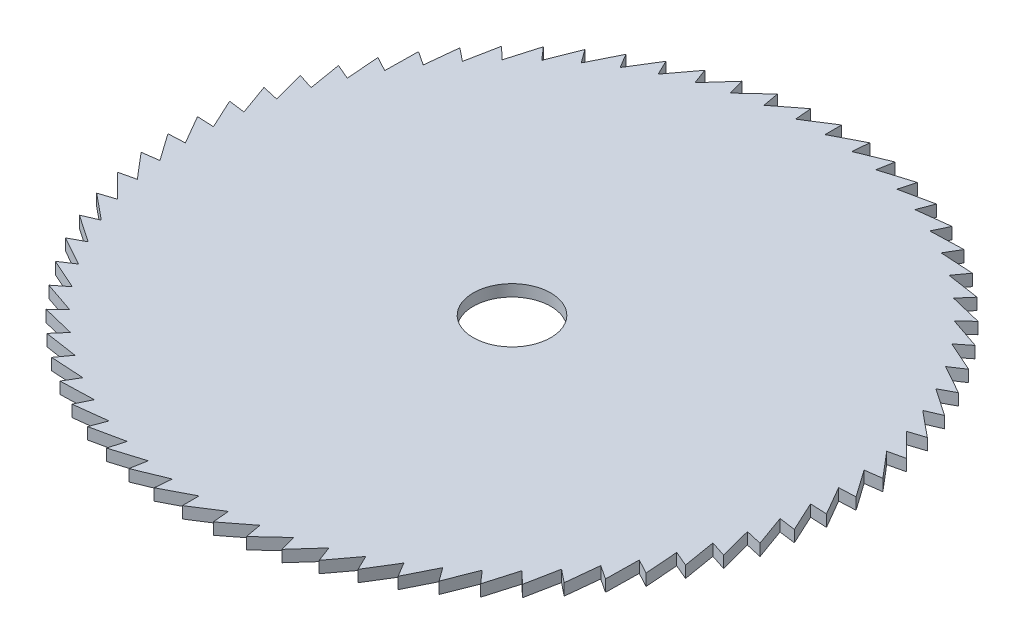
from build123d import *

# Parameters (mm, degrees)
SKETCH_1_R               = 25.5
SKETCH_1_R_2             = 3
EXTRUDE_1_DEPTH          = 0.9
CUT_EXTRUDE_2_DEPTH      = 0.9
PATTERN_CIRCULAR_1_COUNT = 70


with BuildPart() as part:
    # 스케치1 → 보스-돌출1 (new body)
    with BuildSketch(Plane(origin=(0, 0, 0), x_dir=(1, 0, 0), z_dir=(0, 1, 0))):
        Circle(SKETCH_1_R)
        Circle(SKETCH_1_R_2, mode=Mode.SUBTRACT)
    extrude(amount=EXTRUDE_1_DEPTH)

    # 스케치3 → 컷-돌출2 (cut)
    with BuildSketch(Plane(origin=(0, 0.9, 0), x_dir=(1, 0, 0), z_dir=(0, 1, 0))):
        Polygon((0, 25.5), (0, 24.2), (3.797752252, 26.174934679), (0, 26.174934679), align=None)
    cut_extrude_2 = extrude(amount=-CUT_EXTRUDE_2_DEPTH, mode=Mode.SUBTRACT)

    # 원형 패턴1: 컷-돌출2 ×70 about axis
    pattern_circular_1_axis = Axis((0, 0.9, 0), (0, -1, 0))
    for i in range(1, PATTERN_CIRCULAR_1_COUNT):
        add(cut_extrude_2.rotate(pattern_circular_1_axis, i * 360 / PATTERN_CIRCULAR_1_COUNT), mode=Mode.SUBTRACT)


solid = part.part
